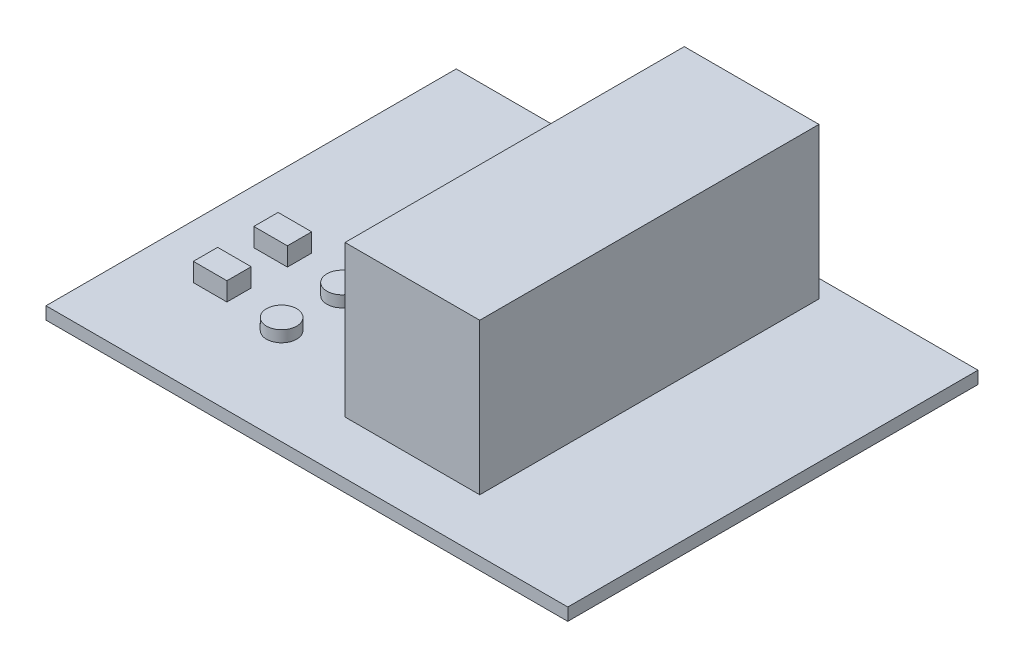
from build123d import *

# Parameters (mm, degrees)
SKETCH1_W           = 69.03
SKETCH1_H           = 54.27
BOSS_EXTRUDE1_DEPTH = 1.65
SKETCH2_R           = 2
BOSS_EXTRUDE2_DEPTH = 1.5
SKETCH3_W           = 4.44
SKETCH3_H           = 3.21
BOSS_EXTRUDE3_DEPTH = 2.44
SKETCH4_W           = 17.82
SKETCH4_H           = 44.88
BOSS_EXTRUDE4_DEPTH = 20


with BuildPart() as part:
    # Sketch1 → Boss-Extrude1 (new body)
    with BuildSketch(Plane(origin=(0, 0, 0), x_dir=(1, 0, 0), z_dir=(0, 1, 0))):
        Rectangle(SKETCH1_W, SKETCH1_H)
    extrude(amount=BOSS_EXTRUDE1_DEPTH)

    # Sketch2 → Boss-Extrude2 (add)
    with BuildSketch(Plane(origin=(0, 1.65, 0), x_dir=(1, 0, 0), z_dir=(0, 1, 0))):
        with Locations((-16.095, -14.385)):
            Circle(SKETCH2_R)
        with Locations((-16.095, -6.385)):
            Circle(SKETCH2_R)
    extrude(amount=BOSS_EXTRUDE2_DEPTH)

    # Sketch3 → Boss-Extrude3 (add)
    with BuildSketch(Plane(origin=(0, 1.65, 0), x_dir=(1, 0, 0), z_dir=(0, 1, 0))):
        with Locations((-25.195, -13.135)):
            Rectangle(SKETCH3_W, SKETCH3_H)
        with Locations((-25.195, -5.135)):
            Rectangle(SKETCH3_W, SKETCH3_H)
    extrude(amount=BOSS_EXTRUDE3_DEPTH)

    # Sketch4 → Boss-Extrude4 (add)
    with BuildSketch(Plane(origin=(0, 1.65, 0), x_dir=(1, 0, 0), z_dir=(0, 1, 0))):
        with Locations((6.925, 2.335)):
            Rectangle(SKETCH4_W, SKETCH4_H)
    extrude(amount=BOSS_EXTRUDE4_DEPTH)


solid = part.part
